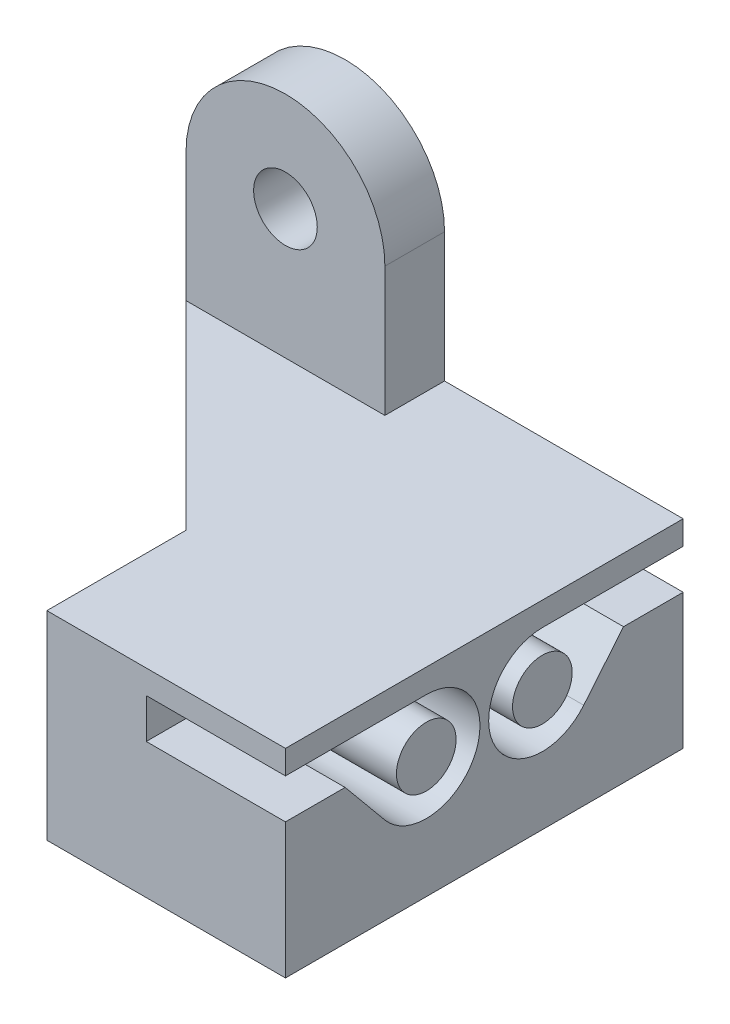
from build123d import *

# Parameters (mm, degrees)
ESBO_O1_R                = 1.6
RESSALTO_EXTRUS_O1_DEPTH = 20
ESBO_O2_W                = 10
ESBO_O2_H                = 36.212539342
CORTE_EXTRUS_O1_DEPTH    = 17
CHANFRO1_SIZE            = 10
ESBO_O3_R                = 1.5
CORTE_EXTRUS_O2_DEPTH    = 7


with BuildPart() as part:
    # Esboço1 → Ressalto-extrusão1 (new body)
    with BuildSketch(Plane.XY):
        with BuildLine():
            Line((5, 12.5), (5, 6))
            Line((5, 6), (17, 6))
            Line((17, 6), (17, -4))
            Line((17, -4), (5, -4))
            Line((5, -4), (5, -12.5))
            ThreePointArc((5, -12.5), (0, -17.5), (-5, -12.5))
            Line((-5, -12.5), (-5, 12.5))
            ThreePointArc((-5, 12.5), (0, 17.5), (5, 12.5))
        make_face()
        with Locations((0, -12.5)):
            Circle(ESBO_O1_R, mode=Mode.SUBTRACT)
        with Locations((0, 12.5)):
            Circle(ESBO_O1_R, mode=Mode.SUBTRACT)
    extrude(amount=RESSALTO_EXTRUS_O1_DEPTH)

    # Esboço2 → Corte-extrusão1 (cut)
    with BuildSketch(Plane.XY.offset(20)):
        Rectangle(ESBO_O2_W, ESBO_O2_H)
    extrude(amount=-CORTE_EXTRUS_O1_DEPTH, mode=Mode.SUBTRACT)

    # Chanfro1
    chanfro1_edges = [part.edges().sort_by_distance(p)[0] for p in [
        (5, 1, 3),
    ]]
    chamfer(chanfro1_edges, length=CHANFRO1_SIZE - 0.0001)  # a hair under: the kernel refuses the full size

    # Esboço3 → Corte-extrusão2 (cut)
    # profile 1 of 2: a face of its own
    with BuildSketch(Plane(origin=(17, 0, 0), x_dir=(0, 0, -1), z_dir=(1, 0, 0))):
        with BuildLine():
            Line((0, 4.8), (-7.081235465, 4.8))
            ThreePointArc((-7.081235465, 4.8), (-9.523984558, 0.949792684), (-5, 0.379982867))
            Line((-5, 0.379982867), (-3, 2.8))
            Line((-3, 2.8), (0, 2.8))
            Line((0, 2.8), (0, 4.8))
        make_face()
        with Locations((-7.081235465, 2.1)):
            Circle(ESBO_O3_R, mode=Mode.SUBTRACT)
    # profile 2 of 2: a face of its own
    with BuildSketch(Plane(origin=(17, 0, 0), x_dir=(0, 0, -1), z_dir=(1, 0, 0))):
        with BuildLine():
            Line((-20, 4.8), (-20, 2.8))
            Line((-20, 2.8), (-17, 2.8))
            Line((-17, 2.8), (-15, 0.379982867))
            ThreePointArc((-15, 0.379982867), (-10.476015442, 0.949792684), (-12.918764535, 4.8))
            Line((-12.918764535, 4.8), (-20, 4.8))
        make_face()
        with Locations(Location((-12.918764535, 2.1, 0), (0, 0, 180))):
            Circle(ESBO_O3_R, mode=Mode.SUBTRACT)
    extrude(amount=-CORTE_EXTRUS_O2_DEPTH, mode=Mode.SUBTRACT)


solid = part.part
